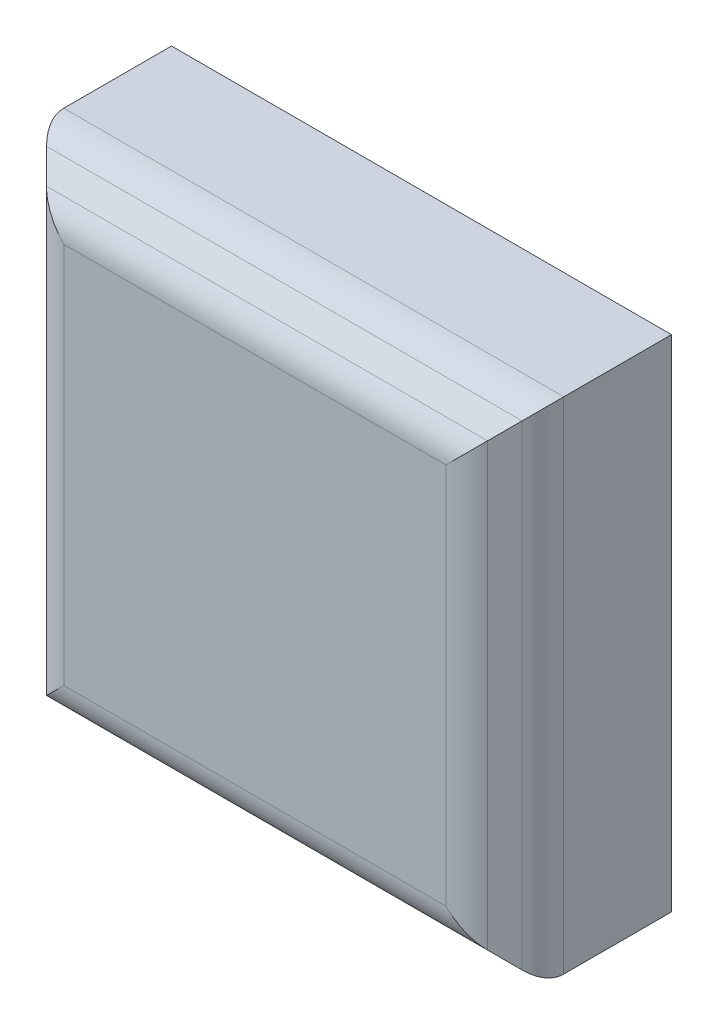
from build123d import *

# Parameters (mm, degrees)
SKETCH1_W           = 120
SKETCH1_H           = 120
BOSS_EXTRUDE1_DEPTH = 40
CHAMFER1_SIZE       = 10
FILLET1_R           = 10
SHELL1_START        = -26.488905171
SHELL1_DEPTH        = 100
SHELL1_START_2      = 5
SHELL1_2_DEPTH      = 102


with BuildPart() as part:
    # Sketch1 → Boss-Extrude1 (new body)
    with BuildSketch(Plane.XY):
        with Locations((23.511094829, 55.943688507)):
            Rectangle(SKETCH1_W, SKETCH1_H)
    extrude(amount=BOSS_EXTRUDE1_DEPTH)

    # Chamfer1
    chamfer1_edges = [part.edges().sort_by_distance(p)[0] for p in [
        (83.511094829, 55.943688507, 40),
        (23.511094829, 115.943688507, 40),
        (-36.488905171, 55.943688507, 40),
        (23.511094829, -4.056311493, 40),
    ]]
    chamfer(chamfer1_edges, length=CHAMFER1_SIZE)

    # Fillet1
    fillet1_edges = [part.edges().sort_by_distance(p)[0] for p in [
        (-26.488905171, 55.943688507, 40),
        (23.511094829, 105.943688507, 40),
        (73.511094829, 55.943688507, 40),
        (23.511094829, 5.943688507, 40),
        (23.511094829, -4.056311493, 30),
        (83.511094829, 55.943688507, 30),
        (23.511094829, 115.943688507, 30),
        (-36.488905171, 55.943688507, 30),
    ]]
    fillet(fillet1_edges, radius=FILLET1_R)

    # Shell1: read off the stored shape, not the designer's step
    # Shell1 outline → Shell1 (cut)
    with BuildSketch(Plane.YZ.offset(SHELL1_START)):
        Polygon((5.943688507, 25.857864376), (5.943688507, 0), (105.943688507, 0), (105.943688507, 25.857864376), (101.801552884, 30), (10.085824131, 30), align=None)
    extrude(amount=SHELL1_DEPTH, mode=Mode.SUBTRACT)

    # Shell1 2 outline → Shell1 2 (add)
    with BuildSketch(Plane(origin=(0, 0, 0), x_dir=(1, 0, 0), z_dir=(0, 1, 0)).offset(SHELL1_START_2)):
        Polygon((73.511094829, -25.857864376), (69.368959206, -30), (73.511094829, -30), align=None)
        Polygon((-22.346769547, -30), (-26.488905171, -25.857864376), (-26.488905171, -30), align=None)
    extrude(amount=SHELL1_2_DEPTH)


solid = part.part
